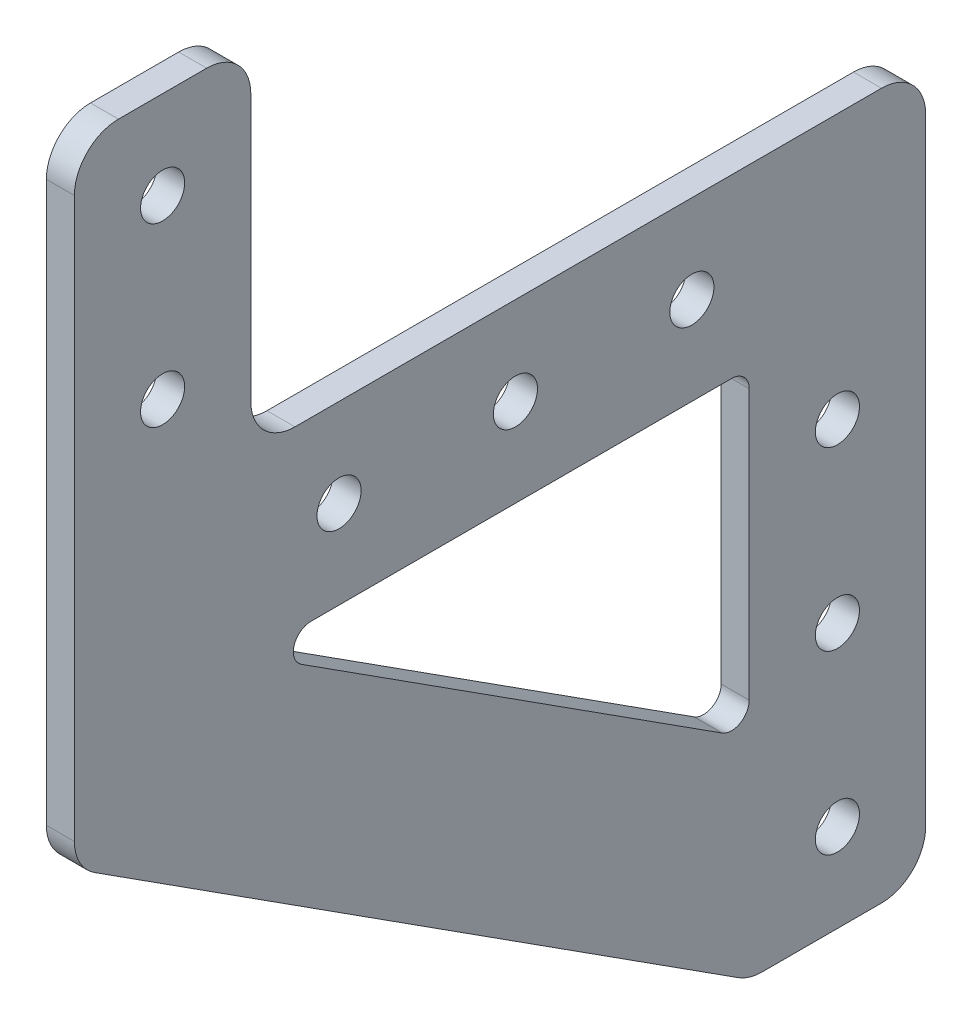
from build123d import *
from OCP.BRepFilletAPI import BRepFilletAPI_MakeFillet

# Parameters (mm, degrees)
SKETCH2_R           = 2.5
BOSS_EXTRUDE1_DEPTH = 3.175
FILLET1_R1          = 5
FILLET1_R2          = 2


with BuildPart() as part:
    # Sketch2 → Boss-Extrude1 (new body)
    with BuildSketch(Plane(origin=(0, 0, 0), x_dir=(0, 0, -1), z_dir=(1, 0, 0))):
        Polygon((-48.25, 50.217645026), (-28.25, 50.217645026), (-28.25, 10), (48.25, 10), (48.25, -70), (28.25, -70), (-48.25, -20.932354974), align=None)
        with Locations((-38.25, 40.217645026)):
            Circle(SKETCH2_R, mode=Mode.SUBTRACT)
        with Locations((-38.25, 20.217645026)):
            Circle(SKETCH2_R, mode=Mode.SUBTRACT)
        with Locations((38.25, -60)):
            Circle(SKETCH2_R, mode=Mode.SUBTRACT)
        with Locations((38.25, -40)):
            Circle(SKETCH2_R, mode=Mode.SUBTRACT)
        with Locations((38.25, -20)):
            Circle(SKETCH2_R, mode=Mode.SUBTRACT)
        with Locations((-18.25, 0)):
            Circle(SKETCH2_R, mode=Mode.SUBTRACT)
        with Locations((1.75, 0)):
            Circle(SKETCH2_R, mode=Mode.SUBTRACT)
        with Locations((21.75, 0)):
            Circle(SKETCH2_R, mode=Mode.SUBTRACT)
        Polygon((28.25, -46.239502536), (28.25, -10), (-28.25, -10), align=None, mode=Mode.SUBTRACT)
    extrude(amount=BOSS_EXTRUDE1_DEPTH)

    # Fillet1: one fillet with a radius per group of edges: ONE call of the kernel's fillet builder (fillet() takes one radius for all edges)
    fillet1_edges_1 = [part.edges().sort_by_distance(p)[0] for p in [
        (1.5875, 50.217645026, 48.25),
        (1.5875, 50.217645026, 28.25),
        (1.5875, 10, 28.25),
        (1.5875, 10, -48.25),
        (1.5875, -70, -48.25),
        (1.5875, -70, -28.25),
        (1.5875, -20.932354974, 48.25),
    ]]
    fillet1_edges_2 = [part.edges().sort_by_distance(p)[0] for p in [
        (1.5875, -10, -28.25),
        (1.5875, -10, 28.25),
        (1.5875, -46.239502536, -28.25),
    ]]
    fillet1 = BRepFilletAPI_MakeFillet(part.part.solid().wrapped)
    for e in fillet1_edges_1:
        fillet1.Add(FILLET1_R1, e.wrapped)
    for e in fillet1_edges_2:
        fillet1.Add(FILLET1_R2, e.wrapped)
    add(Compound.cast(fillet1.Shape()), mode=Mode.REPLACE)


solid = part.part
